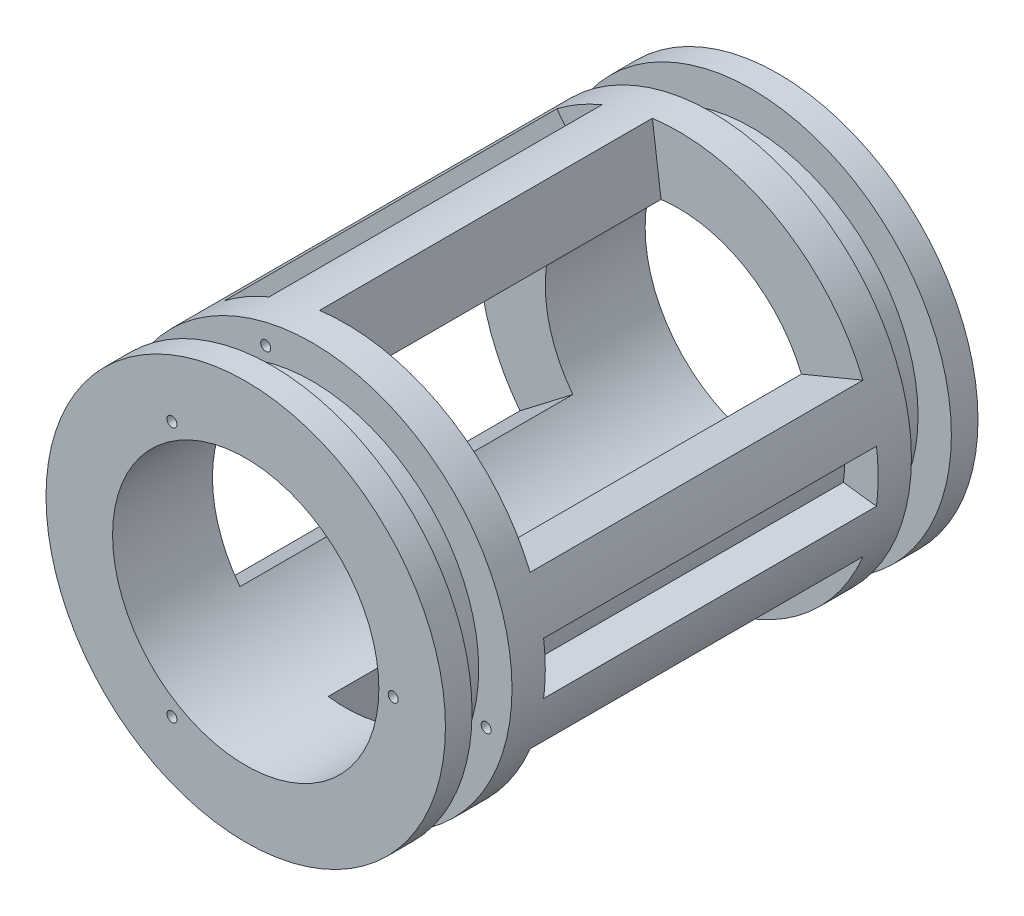
from build123d import *
from build123d.topology import SkipClean

# Parameters (mm, degrees)
SKETCH_1_R               = 25
SKETCH_1_R_2             = 20
EXTRUDE_1_DEPTH          = 40
EXTRUDE_START            = -15
SKETCH_2_R               = 30
SKETCH_2_R_2             = 25
EXTRUDE_2_DEPTH          = 15
EXTRUDE_START_2          = 25
EXTRUDE_3_DEPTH          = 25
PATTERN_CIRCULAR_1_COUNT = 3
CUT_EXTRUDE_1_DEPTH      = 25
PATTERN_CIRCULAR_2_COUNT = 3
SKETCH_6_R               = 0.75
CUT_EXTRUDE_2_DEPTH      = 40
PATTERN_CIRCULAR_4_COUNT = 3
CUT_EXTRUDE_3_DEPTH      = 3
CUT_EXTRUDE_3_DEPTH_BACK = 3
SKETCH_11_R              = 30
SKETCH_11_R_2            = 25
SKETCH_13_R              = 0.75
CUT_EXTRUDE_5_DEPTH      = 52.961524285
PATTERN_CIRCULAR_3_COUNT = 3


with BuildPart() as part:
    # 草图1 → 凸台-拉伸1 (new body)
    with BuildSketch(Plane.XY):
        Circle(SKETCH_1_R)
        Circle(SKETCH_1_R_2, mode=Mode.SUBTRACT)
    extrude(amount=EXTRUDE_1_DEPTH)

    # 草图2 → 凸台-拉伸2 (add)
    with BuildSketch(Plane.XY.offset(40).offset(EXTRUDE_START)):
        Circle(SKETCH_2_R)
        Circle(SKETCH_2_R_2, mode=Mode.SUBTRACT)
    extrude(amount=EXTRUDE_2_DEPTH)

    # 草图3 → 凸台-拉伸3 (add)
    with BuildSketch(Plane(origin=(0, 0, 25), x_dir=(-1, 0, 0), z_dir=(0, 0, -1)).offset(EXTRUDE_START_2)):
        with BuildLine():
            Line((-24.786121534, 3.263154806), (-29.743345841, 3.915785767))
            ThreePointArc((-29.743345841, 3.915785767), (-28.977774789, 7.764571353), (-27.716385975, 11.480502971))
            Line((-27.716385975, 11.480502971), (-23.096988313, 9.567085809))
            ThreePointArc((-23.096988313, 9.567085809), (-24.148145657, 6.470476128), (-24.786121534, 3.263154806))
        make_face()
        with BuildLine():
            Line((-29.743345841, -3.915785767), (-24.786121534, -3.263154806))
            ThreePointArc((-24.786121534, -3.263154806), (-24.148145657, -6.470476128), (-23.096988313, -9.567085809))
            Line((-23.096988313, -9.567085809), (-27.716385975, -11.480502971))
            ThreePointArc((-27.716385975, -11.480502971), (-28.977774789, -7.764571353), (-29.743345841, -3.915785767))
        make_face()
    extrude_3 = extrude(amount=-EXTRUDE_3_DEPTH)

    # 阵列(圆周)1: 凸台-拉伸3 ×3 about axis
    pattern_circular_1_axis = Axis((0, 0, 0), (0, 0, 1))
    for i in range(1, PATTERN_CIRCULAR_1_COUNT):
        add(extrude_3.rotate(pattern_circular_1_axis, i * 360 / PATTERN_CIRCULAR_1_COUNT))

    # 草图5 → 切除-拉伸1 (cut)
    with BuildSketch(Plane(origin=(0, 0, 0), x_dir=(-1, 0, 0), z_dir=(0, 0, -1))):
        with BuildLine():
            Line((-23.096988313, 9.567085809), (-18.47759065, 7.653668647))
            ThreePointArc((-18.47759065, 7.653668647), (-10, 17.320508076), (2.610523844, 19.828897227))
            Line((2.610523844, 19.828897227), (3.263154806, 24.786121534))
            ThreePointArc((3.263154806, 24.786121534), (-12.5, 21.650635095), (-23.096988313, 9.567085809))
        make_face()
    cut_extrude_1 = extrude(amount=-CUT_EXTRUDE_1_DEPTH, mode=Mode.SUBTRACT)

    # 阵列(圆周)2: 切除-拉伸1 ×3 about axis
    pattern_circular_2_axis = Axis((0, 0, 40), (0, 0, -1))
    for i in range(1, PATTERN_CIRCULAR_2_COUNT):
        add(cut_extrude_1.rotate(pattern_circular_2_axis, i * 360 / PATTERN_CIRCULAR_2_COUNT), mode=Mode.SUBTRACT)

    # 草图6 → 切除-拉伸2 (cut)
    with BuildSketch(Plane.XY.offset(40)):
        with Locations((-11.079175501, 19.189694874)):
            Circle(SKETCH_6_R)
        with Locations((22.158351002, 0)):
            Circle(SKETCH_6_R)
        with Locations((-11.079175501, -19.189694874)):
            Circle(SKETCH_6_R)
    extrude(amount=-CUT_EXTRUDE_2_DEPTH, mode=Mode.SUBTRACT)

    # 草图10 → 切除-旋转3 (revolve, cut)
    with SkipClean():  # the faces are left unmerged after this step: merging them gives an invalid solid
        with BuildSketch(Plane(origin=(0, 0, 0), x_dir=(-1, 0, 0), z_dir=(0, 0, -1))):
            with BuildLine():
                ThreePointArc((-22.908351002, 0), (-22.688681088, 0.530330086), (-22.158351002, 0.75))
                Line((-22.158351002, 0.75), (-24.988747468, 0.75))
                ThreePointArc((-24.988747468, 0.75), (-24.997186709, 0.375042204), (-25, 0))
                Line((-25, 0), (-22.908351002, 0))
            make_face()
            with BuildLine():
                Line((-22.158351002, 0), (-22.158351002, 0.75))
                ThreePointArc((-22.158351002, 0.75), (-22.688681088, 0.530330086), (-22.908351002, 0))
                Line((-22.908351002, 0), (-22.158351002, 0))
            make_face()
            with BuildLine():
                Line((-22.158351002, -0.75), (-22.158351002, 0))
                Line((-22.158351002, 0), (-22.908351002, 0))
                ThreePointArc((-22.908351002, 0), (-22.688681088, -0.530330086), (-22.158351002, -0.75))
            make_face()
            with BuildLine():
                ThreePointArc((-25, 0), (-24.997186709, 0.375042204), (-24.988747468, 0.75))
                Line((-24.988747468, 0.75), (-26.146421449, 0.75))
                Line((-26.146421449, 0.75), (-26.146421449, 0))
                Line((-26.146421449, 0), (-25, 0))
            make_face()
        cut_revolve_3 = revolve(axis=Axis((22.158351002, 0, 0), (1, 0, 0)), mode=Mode.SUBTRACT)
    add(part.part.scale(1), mode=Mode.REPLACE)  # the faces are merged on a copy

    # 阵列(圆周)4: 切除-旋转3 ×3 about axis
    pattern_circular_4_axis = Axis((0, 0, 40), (0, 0, -1))
    for i in range(1, PATTERN_CIRCULAR_4_COUNT):
        add(cut_revolve_3.rotate(pattern_circular_4_axis, i * 360 / PATTERN_CIRCULAR_4_COUNT), mode=Mode.SUBTRACT)

    # 草图11 → 切除-拉伸3 (cut, two sides: drawn at the far end of the back side and taken through both)
    with BuildSketch(Plane.XY.offset(33).offset(-CUT_EXTRUDE_3_DEPTH_BACK)):
        Circle(SKETCH_11_R)
        Circle(SKETCH_11_R_2, mode=Mode.SUBTRACT)
    extrude(amount=CUT_EXTRUDE_3_DEPTH + CUT_EXTRUDE_3_DEPTH_BACK, mode=Mode.SUBTRACT)

    # 草图13 → 切除-拉伸5 (cut, through all)
    with BuildSketch(Plane.XY.offset(30)):
        with Locations((-6.998313063, 26.118059917)):
            Circle(SKETCH_13_R)
    cut_extrude_5 = extrude(amount=-CUT_EXTRUDE_5_DEPTH, mode=Mode.SUBTRACT)

    # 阵列(圆周)3: 切除-拉伸5 ×3 about axis
    pattern_circular_3_axis = Axis((0, 0, 0), (0, 0, 1))
    for i in range(1, PATTERN_CIRCULAR_3_COUNT):
        add(cut_extrude_5.rotate(pattern_circular_3_axis, i * 360 / PATTERN_CIRCULAR_3_COUNT), mode=Mode.SUBTRACT)

    # 镜向1: part across face


with BuildPart() as part_1:
    add(part.part)
    add(part.part.mirror(Plane(origin=(-11.959573357, -20.875780488, 0), x_dir=(1, 0, 0), z_dir=(0, 0, -1))))


solid = part_1.part
